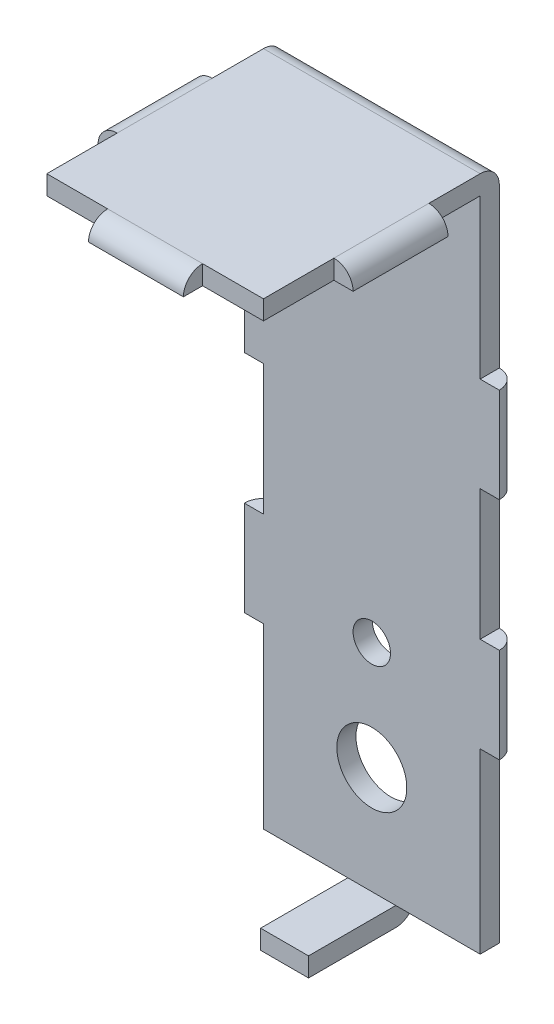
from build123d import *

# Parameters (mm, degrees)
SKETCH1_W           = 22.6
SKETCH1_H           = 70.5
BOSS_EXTRUDE1_DEPTH = 2
SKETCH2_W           = 22.6
SKETCH2_H           = 2
BOSS_EXTRUDE2_DEPTH = 22.6
SKETCH3_W           = 2
SKETCH3_H           = 9.9
SKETCH3_W_2         = 9.9
SKETCH3_H_2         = 2
BOSS_EXTRUDE3_DEPTH = 2
SKETCH4_W           = 2
SKETCH4_H           = 9.9
BOSS_EXTRUDE4_DEPTH = 2
FILLET1_R           = 2
SKETCH5_W           = 5
SKETCH5_H           = 2
BOSS_EXTRUDE5_DEPTH = 11.1
FILLET2_R           = 2
SKETCH6_R           = 3.65
SKETCH6_R_2         = 1.95
CUT_EXTRUDE1_DEPTH  = 2


with BuildPart() as part:
    # Sketch1 → Boss-Extrude1 (new body)
    with BuildSketch(Plane.XY):
        Rectangle(SKETCH1_W, SKETCH1_H)
    extrude(amount=BOSS_EXTRUDE1_DEPTH)

    # Sketch2 → Boss-Extrude2 (add)
    with BuildSketch(Plane.XY.offset(2)):
        with Locations((0, 34.25)):
            Rectangle(SKETCH2_W, SKETCH2_H)
    extrude(amount=BOSS_EXTRUDE2_DEPTH)

    # Sketch3 → Boss-Extrude3 (add)
    with BuildSketch(Plane(origin=(0, 35.25, 0), x_dir=(1, 0, 0), z_dir=(0, 1, 0))):
        with Locations((-12.3, -12.3)):
            Rectangle(SKETCH3_W, SKETCH3_H)
        with Locations((12.3, -12.3)):
            Rectangle(SKETCH3_W, SKETCH3_H)
        with Locations((0, -25.6)):
            Rectangle(SKETCH3_W_2, SKETCH3_H_2)
    extrude(amount=-BOSS_EXTRUDE3_DEPTH)

    # Sketch4 → Boss-Extrude4 (add)
    with BuildSketch(Plane.XY.offset(2)):
        with Locations((12.3, 11.75)):
            Rectangle(SKETCH4_W, SKETCH4_H)
        with Locations((12.3, -11.75)):
            Rectangle(SKETCH4_W, SKETCH4_H)
        with Locations((-12.3, -11.75)):
            Rectangle(SKETCH4_W, SKETCH4_H)
        with Locations((-12.3, 11.75)):
            Rectangle(SKETCH4_W, SKETCH4_H)
    extrude(amount=-BOSS_EXTRUDE4_DEPTH)

    # Fillet1
    # the kernel refuses this fillet: 2 mm, written as the material it takes off along each edge
    with BuildSketch(Plane(origin=(16.3, 35.25, 0), x_dir=(0, -1, 0), z_dir=(-1, 0, 0))) as fillet1_piece_1:
        with BuildLine():
            CenterArc((FILLET1_R, FILLET1_R), FILLET1_R, 180, 90)
            Line((0, FILLET1_R), (0, 0))
            Line((0, 0), (FILLET1_R, 0))
        make_face()
    extrude(amount=32.6, mode=Mode.SUBTRACT)
    with BuildSketch(Plane(origin=(13.3, 35.25, 2.35), x_dir=(-1, 0, 0), z_dir=(0, 0, 1)), Plane(origin=(9.95, 35.25, 26.6), x_dir=(0, 0, -1), z_dir=(-1, 0, 0)), Plane(origin=(-13.3, 35.25, 22.25), x_dir=(1, 0, 0), z_dir=(0, 0, -1)), Plane(origin=(13.3, 1.8, 0), x_dir=(-1, 0, 0), z_dir=(0, 1, 0)), Plane(origin=(13.3, -21.7, 0), x_dir=(-1, 0, 0), z_dir=(0, 1, 0))) as fillet1_piece_2:
        with BuildLine():
            CenterArc((FILLET1_R, FILLET1_R), FILLET1_R, 180, 90)
            Line((0, FILLET1_R), (0, 0))
            Line((0, 0), (FILLET1_R, 0))
        make_face()
    extrude(amount=19.9, mode=Mode.SUBTRACT)
    with BuildSketch(Plane(origin=(-13.3, -21.7, 0), x_dir=(1, 0, 0), z_dir=(0, 1, 0)), Plane(origin=(-13.3, 1.8, 0), x_dir=(1, 0, 0), z_dir=(0, 1, 0))) as fillet1_piece_3:
        with BuildLine():
            CenterArc((FILLET1_R, -FILLET1_R), FILLET1_R, 90, 90)
            Line((0, -FILLET1_R), (0, 0))
            Line((0, 0), (FILLET1_R, 0))
        make_face()
    extrude(amount=19.9, mode=Mode.SUBTRACT)

    # Sketch5 → Boss-Extrude5 (add)
    with BuildSketch(Plane(origin=(0, 0, 0), x_dir=(-1, 0, 0), z_dir=(0, 0, -1))):
        with Locations((0, -36.25)):
            Rectangle(SKETCH5_W, SKETCH5_H)
    extrude(amount=-BOSS_EXTRUDE5_DEPTH)

    # Fillet2
    fillet2_edges = [part.edges().sort_by_distance(p)[0] for p in [
        (0, -37.25, 0),
    ]]
    fillet(fillet2_edges, radius=FILLET2_R)

    # Sketch6 → Cut-Extrude1 (cut)
    with BuildSketch(Plane(origin=(0, 0, 0), x_dir=(-1, 0, 0), z_dir=(0, 0, -1))):
        with Locations((0, -24.05)):
            Circle(SKETCH6_R)
        with Locations((0, -12.75)):
            Circle(SKETCH6_R_2)
    extrude(amount=-CUT_EXTRUDE1_DEPTH, mode=Mode.SUBTRACT)


solid = part.part
